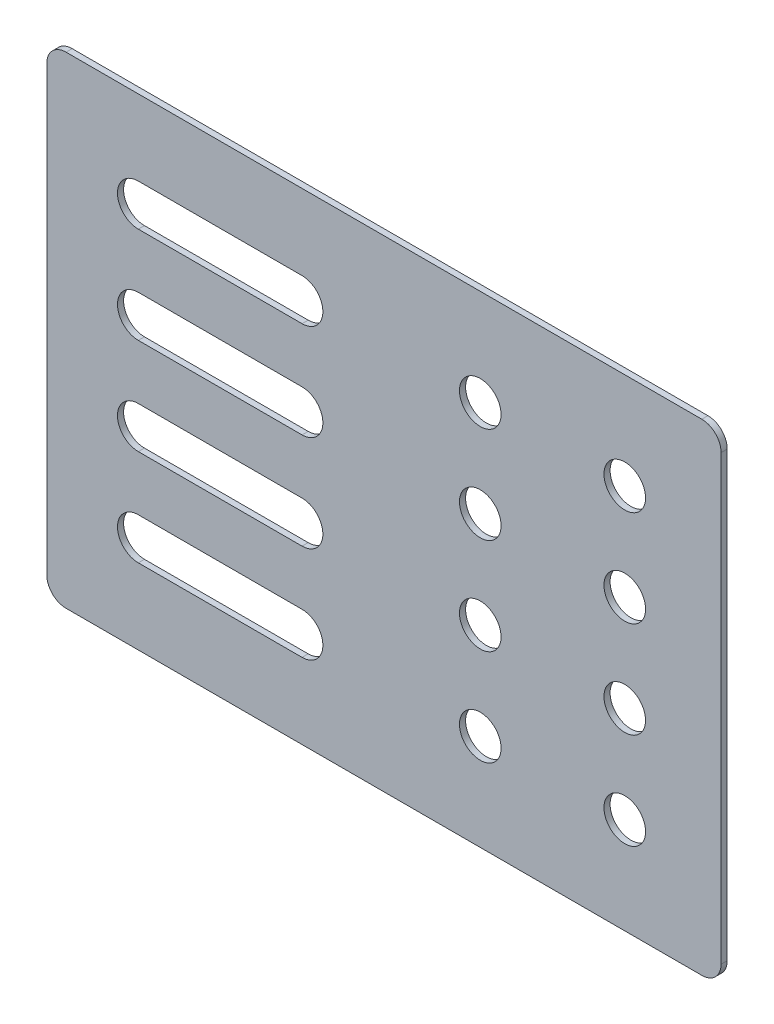
from build123d import *

# Parameters (mm, degrees)
SKETCH1_W           = 70
SKETCH1_H           = 50
SKETCH1_R           = 2.16
BOSS_EXTRUDE1_DEPTH = 0.635
FILLET1_R           = 2


with BuildPart() as part:
    # Sketch1 → Boss-Extrude1 (new body)
    with BuildSketch(Plane.XY):
        with Locations((35, -25)):
            Rectangle(SKETCH1_W, SKETCH1_H)
        with BuildLine():
            Line((20, -42.16), (9.5, -42.16))
            ThreePointArc((9.5, -42.16), (7.34, -40), (9.5, -37.84))
            Line((9.5, -37.84), (20, -37.84))
            Line((20, -37.84), (26.5, -37.84))
            ThreePointArc((26.5, -37.84), (28.66, -40), (26.5, -42.16))
            Line((26.5, -42.16), (20, -42.16))
        make_face(mode=Mode.SUBTRACT)
        with BuildLine():
            Line((20, -32.16), (9.5, -32.16))
            ThreePointArc((9.5, -32.16), (7.34, -30), (9.5, -27.84))
            Line((9.5, -27.84), (20, -27.84))
            Line((20, -27.84), (26.5, -27.84))
            ThreePointArc((26.5, -27.84), (28.66, -30), (26.5, -32.16))
            Line((26.5, -32.16), (20, -32.16))
        make_face(mode=Mode.SUBTRACT)
        with Locations((45, -40)):
            Circle(SKETCH1_R, mode=Mode.SUBTRACT)
        with Locations((60, -40)):
            Circle(SKETCH1_R, mode=Mode.SUBTRACT)
        with Locations((45, -30)):
            Circle(SKETCH1_R, mode=Mode.SUBTRACT)
        with Locations((60, -30)):
            Circle(SKETCH1_R, mode=Mode.SUBTRACT)
        with BuildLine():
            Line((20, -22.16), (9.5, -22.16))
            ThreePointArc((9.5, -22.16), (7.34, -20), (9.5, -17.84))
            Line((9.5, -17.84), (20, -17.84))
            Line((20, -17.84), (26.5, -17.84))
            ThreePointArc((26.5, -17.84), (28.66, -20), (26.5, -22.16))
            Line((26.5, -22.16), (20, -22.16))
        make_face(mode=Mode.SUBTRACT)
        with BuildLine():
            ThreePointArc((9.5, -12.16), (7.34, -10), (9.5, -7.84))
            Line((9.5, -7.84), (20, -7.84))
            Line((20, -7.84), (26.5, -7.84))
            ThreePointArc((26.5, -7.84), (28.66, -10), (26.5, -12.16))
            Line((26.5, -12.16), (20, -12.16))
            Line((20, -12.16), (9.5, -12.16))
        make_face(mode=Mode.SUBTRACT)
        with Locations((45, -20)):
            Circle(SKETCH1_R, mode=Mode.SUBTRACT)
        with Locations((60, -20)):
            Circle(SKETCH1_R, mode=Mode.SUBTRACT)
        with Locations((45, -10)):
            Circle(SKETCH1_R, mode=Mode.SUBTRACT)
        with Locations((60, -10)):
            Circle(SKETCH1_R, mode=Mode.SUBTRACT)
    extrude(amount=BOSS_EXTRUDE1_DEPTH)

    # Fillet1
    fillet1_edges = [part.edges().sort_by_distance(p)[0] for p in [
        (70, -50, 0.3175),
        (0, -50, 0.3175),
        (70, 0, 0.3175),
        (0, 0, 0.3175),
    ]]
    fillet(fillet1_edges, radius=FILLET1_R)


solid = part.part
